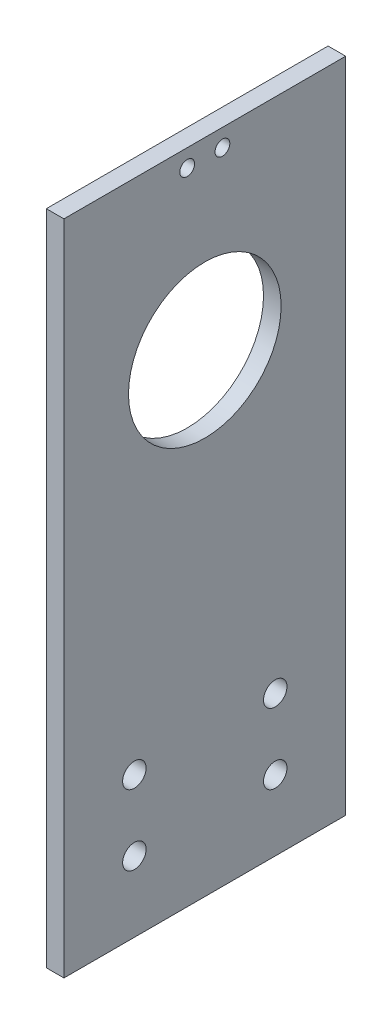
from build123d import *

# Parameters (mm, degrees)
SKETCH1_W           = 76.2
SKETCH1_H           = 177.8
BOSS_EXTRUDE1_DEPTH = 4.7625
CUT_EXTRUDE1_REACH  = 98.838
SKETCH2_R           = 20.6375
CUT_EXTRUDE2_REACH  = 98.838
SKETCH4_R           = 3.175
CUT_EXTRUDE3_REACH  = 98.838
SKETCH5_R           = 2


with BuildPart() as part:
    # Sketch1 → Boss-Extrude1 (new body)
    with BuildSketch(Plane(origin=(0, 0, 0), x_dir=(0, 0, -1), z_dir=(1, 0, 0))):
        Rectangle(SKETCH1_W, SKETCH1_H)
    extrude(amount=BOSS_EXTRUDE1_DEPTH)

    # Sketch2 → Cut-Extrude1 (cut, up to next)
    with BuildSketch(Plane(origin=(4.7625, 0, 0), x_dir=(0, 0, -1), z_dir=(1, 0, 0)), mode=Mode.PRIVATE) as cut_extrude1_sk1:
        with Locations((0, 39.116)):
            Circle(SKETCH2_R)
    cut_extrude1_tool1 = extrude(cut_extrude1_sk1.sketch, amount=-CUT_EXTRUDE1_REACH, mode=Mode.PRIVATE) & part.part
    add(cut_extrude1_tool1.solids().sort_by_distance((4.7625, 39.116, 0))[0], mode=Mode.SUBTRACT)

    # Sketch4 → Cut-Extrude2 (cut, up to next)
    with BuildSketch(Plane(origin=(4.7625, 0, 0), x_dir=(0, 0, -1), z_dir=(1, 0, 0)), mode=Mode.PRIVATE) as cut_extrude2_sk1:
        with Locations((-19.05, -50.8)):
            Circle(SKETCH4_R)
    cut_extrude2_tool1 = extrude(cut_extrude2_sk1.sketch, amount=-CUT_EXTRUDE2_REACH, mode=Mode.PRIVATE) & part.part
    # Sketch4 → Cut-Extrude2 (cut, up to next)
    with BuildSketch(Plane(origin=(4.7625, 0, 0), x_dir=(0, 0, -1), z_dir=(1, 0, 0)), mode=Mode.PRIVATE) as cut_extrude2_sk2:
        with Locations((19.05, -50.8)):
            Circle(SKETCH4_R)
    cut_extrude2_tool2 = extrude(cut_extrude2_sk2.sketch, amount=-CUT_EXTRUDE2_REACH, mode=Mode.PRIVATE) & part.part
    # Sketch4 → Cut-Extrude2 (cut, up to next)
    with BuildSketch(Plane(origin=(4.7625, 0, 0), x_dir=(0, 0, -1), z_dir=(1, 0, 0)), mode=Mode.PRIVATE) as cut_extrude2_sk3:
        with Locations((19.05, -69.85)):
            Circle(SKETCH4_R)
    cut_extrude2_tool3 = extrude(cut_extrude2_sk3.sketch, amount=-CUT_EXTRUDE2_REACH, mode=Mode.PRIVATE) & part.part
    # Sketch4 → Cut-Extrude2 (cut, up to next)
    with BuildSketch(Plane(origin=(4.7625, 0, 0), x_dir=(0, 0, -1), z_dir=(1, 0, 0)), mode=Mode.PRIVATE) as cut_extrude2_sk4:
        with Locations((-19.05, -69.85)):
            Circle(SKETCH4_R)
    cut_extrude2_tool4 = extrude(cut_extrude2_sk4.sketch, amount=-CUT_EXTRUDE2_REACH, mode=Mode.PRIVATE) & part.part
    add(cut_extrude2_tool1.solids().sort_by_distance((4.7625, -50.8, 19.05))[0], mode=Mode.SUBTRACT)
    add(cut_extrude2_tool2.solids().sort_by_distance((4.7625, -50.8, -19.05))[0], mode=Mode.SUBTRACT)
    add(cut_extrude2_tool3.solids().sort_by_distance((4.7625, -69.85, -19.05))[0], mode=Mode.SUBTRACT)
    add(cut_extrude2_tool4.solids().sort_by_distance((4.7625, -69.85, 19.05))[0], mode=Mode.SUBTRACT)

    # Sketch5 → Cut-Extrude3 (cut, up to next)
    with BuildSketch(Plane(origin=(4.7625, 0, 0), x_dir=(0, 0, -1), z_dir=(1, 0, 0)), mode=Mode.PRIVATE) as cut_extrude3_sk1:
        with Locations((-4.7625, 84.1375)):
            Circle(SKETCH5_R)
    cut_extrude3_tool1 = extrude(cut_extrude3_sk1.sketch, amount=-CUT_EXTRUDE3_REACH, mode=Mode.PRIVATE) & part.part
    # Sketch5 → Cut-Extrude3 (cut, up to next)
    with BuildSketch(Plane(origin=(4.7625, 0, 0), x_dir=(0, 0, -1), z_dir=(1, 0, 0)), mode=Mode.PRIVATE) as cut_extrude3_sk2:
        with Locations((4.7625, 84.1375)):
            Circle(SKETCH5_R)
    cut_extrude3_tool2 = extrude(cut_extrude3_sk2.sketch, amount=-CUT_EXTRUDE3_REACH, mode=Mode.PRIVATE) & part.part
    add(cut_extrude3_tool1.solids().sort_by_distance((4.7625, 84.1375, 4.7625))[0], mode=Mode.SUBTRACT)
    add(cut_extrude3_tool2.solids().sort_by_distance((4.7625, 84.1375, -4.7625))[0], mode=Mode.SUBTRACT)


solid = part.part
